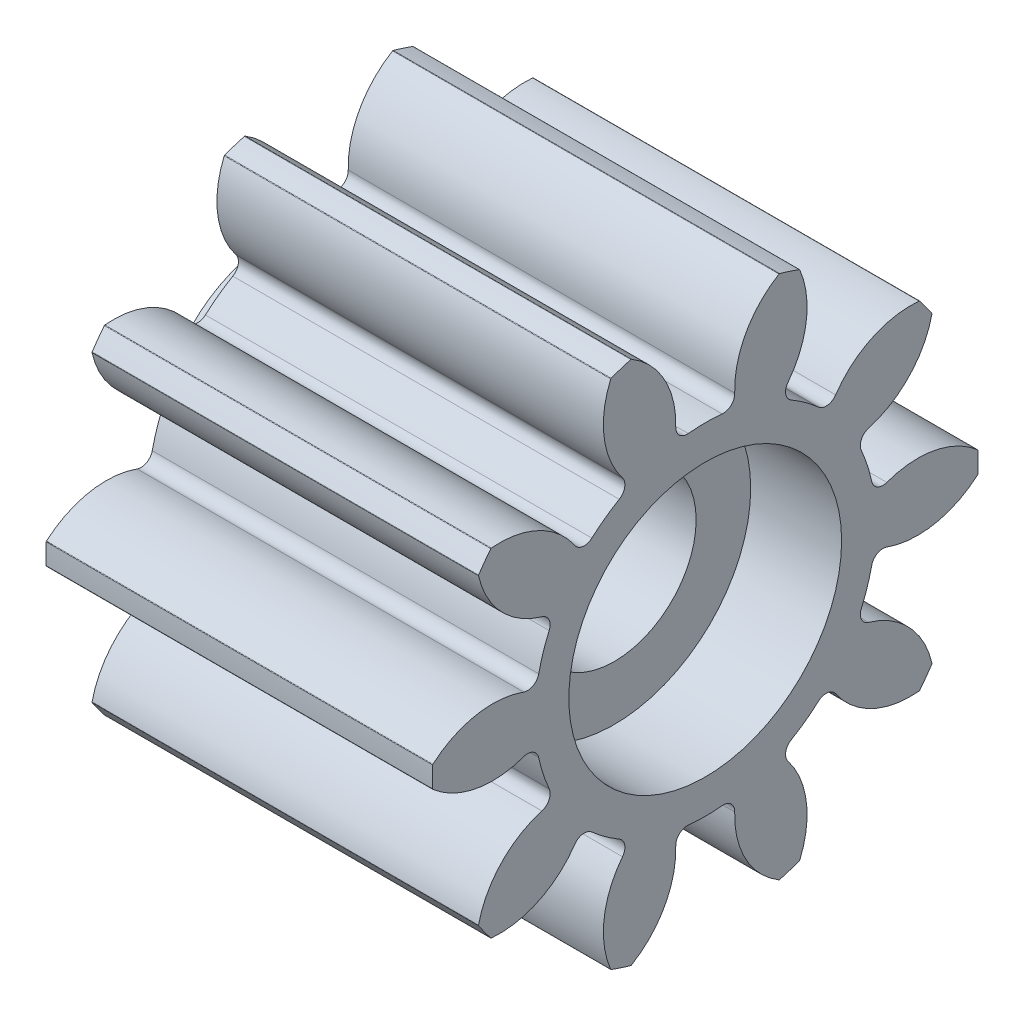
from build123d import *
from build123d.topology import SkipClean

# Parameters (mm, degrees)
BASPROSKE_W                = 8.5
BASPROSKE_H                = 6
TOOTHCUT_DEPTH             = 13.010412149
BREAKS_R                   = 0.02
ROOTFILLETS_R              = 0.251
TEETHCUTS_COUNT            = 10
TEETHCUTS_ANGLE            = 324
BREAKS_OF_TEETHCUTS_R      = 0.02
ROOTFILLETS_OF_TEETHCUTS_R = 0.251
BORSKE_R                   = 1.8
BORE_DEPTH                 = 50.0000508
SKETCH3_R                  = 2.5
SKETCH3_R_2                = 1.8
BOSS_EXTRUDE1_DEPTH        = 1
SKETCH4_R                  = 3
CUT_EXTRUDE2_DEPTH         = 2


with BuildPart() as part:
    # BasProSke → Base-Revolve (revolve)
    with BuildSketch(Plane(origin=(0, 0, 0), x_dir=(1, 0, 0), z_dir=(0, 1, 0))):
        with Locations((4.25, 3)):
            Rectangle(BASPROSKE_W, BASPROSKE_H)
    revolve(axis=Axis((-10, 0, 0), (1, 0, 0)))

    # TooCutSke → ToothCut (cut, through all)
    with BuildSketch(Plane(origin=(0, 0, 0), x_dir=(0, 0, -1), z_dir=(1, 0, 0))):
        with BuildLine():
            ThreePointArc((0.680948119, 3.686639481), (0, 3.749), (-0.680948119, 3.686639481))
            ThreePointArc((-0.680948119, 3.686639481), (-0.833594699, 4.896067871), (-1.659981216, 5.7922282))
            ThreePointArc((-1.659981216, 5.7922282), (0, 6.0254), (1.659981216, 5.7922282))
            ThreePointArc((1.659981216, 5.7922282), (0.833594699, 4.896067871), (0.680948119, 3.686639481))
        make_face()
    toothcut = extrude(amount=TOOTHCUT_DEPTH, mode=Mode.SUBTRACT)

    # Breaks
    breaks_edges = [part.edges().sort_by_distance(p)[0] for p in [
        (4.25, 5.774516397, -1.629404918),
        (4.25, 5.774516397, 1.629404918),
    ]]
    fillet(breaks_edges, radius=BREAKS_R)

    # RootFillets
    rootfillets_edges = [part.edges().sort_by_distance(p)[0] for p in [
        (4.25, 3.686639481, -0.680948119),
        (4.25, 3.686639481, 0.680948119),
    ]]
    fillet(rootfillets_edges, radius=ROOTFILLETS_R)

    # TeethCuts: ToothCut ×10 about axis
    teethcuts_axis = Axis((-10, 0, 0), (1, 0, 0))
    for i in range(1, TEETHCUTS_COUNT):
        add(toothcut.rotate(teethcuts_axis, i * TEETHCUTS_ANGLE / (TEETHCUTS_COUNT - 1)), mode=Mode.SUBTRACT)

    # Breaks of TeethCuts
    breaks_of_teethcuts_edges = [part.edges().sort_by_distance(p)[0] for p in [
        (4.25, 5.62942208, 2.075959308),
        (4.25, 3.713941719, 4.712391846),
        (4.25, 3.334079865, 4.988377637),
        (4.25, 0.234767536, 5.995405258),
        (4.25, -0.234767536, 5.995405258),
        (4.25, -3.334079865, 4.988377637),
        (4.25, -3.713941719, 4.712391846),
        (4.25, -5.62942208, 2.075959308),
        (4.25, -5.774516397, 1.629404918),
        (4.25, -5.774516397, -1.629404918),
        (4.25, -5.62942208, -2.075959308),
        (4.25, -3.713941719, -4.712391846),
        (4.25, -3.334079865, -4.988377637),
        (4.25, -0.234767536, -5.995405258),
        (4.25, 0.234767536, -5.995405258),
        (4.25, 3.334079865, -4.988377637),
        (4.25, 3.713941719, -4.712391846),
        (4.25, 5.62942208, -2.075959308),
    ]]
    fillet(breaks_of_teethcuts_edges, radius=BREAKS_OF_TEETHCUTS_R)

    # RootFillets of TeethCuts
    rootfillets_of_teethcuts_edges = [part.edges().sort_by_distance(p)[0] for p in [
        (4.25, 3.382805254, 1.616053717),
        (4.25, 2.58230273, 2.717850918),
        (4.25, 1.786854397, 3.29577796),
        (4.25, 0.491614106, 3.716627042),
        (4.25, -0.491614106, 3.716627042),
        (4.25, -1.786854397, 3.29577796),
        (4.25, -2.58230273, 2.717850918),
        (4.25, -3.382805254, 1.616053717),
        (4.25, -3.686639481, 0.680948119),
        (4.25, -3.686639481, -0.680948119),
        (4.25, -3.382805254, -1.616053717),
        (4.25, -2.58230273, -2.717850918),
        (4.25, -1.786854397, -3.29577796),
        (4.25, -0.491614106, -3.716627042),
        (4.25, 0.491614106, -3.716627042),
        (4.25, 1.786854397, -3.29577796),
        (4.25, 2.58230273, -2.717850918),
        (4.25, 3.382805254, -1.616053717),
    ]]
    fillet(rootfillets_of_teethcuts_edges, radius=ROOTFILLETS_OF_TEETHCUTS_R)

    # BorSke → Bore (cut, symmetric)
    with BuildSketch(Plane(origin=(0, 0, 0), x_dir=(0, 0, -1), z_dir=(1, 0, 0))):
        Circle(BORSKE_R)
    extrude(amount=BORE_DEPTH, both=True, mode=Mode.SUBTRACT)

    # Sketch3 → Boss-Extrude1 (add)
    with SkipClean():  # the faces are left unmerged after this step: merging them gives an invalid solid
        with BuildSketch(Plane.ZY):
            Circle(SKETCH3_R)
            Circle(SKETCH3_R_2, mode=Mode.SUBTRACT)
        extrude(amount=BOSS_EXTRUDE1_DEPTH)

    # Sketch4 → Cut-Extrude2 (cut)
    with SkipClean():  # the faces are left unmerged after this step: merging them gives an invalid solid
        with BuildSketch(Plane(origin=(8.5, 0, 0), x_dir=(0, 0, -1), z_dir=(1, 0, 0))):
            Circle(SKETCH4_R)
        extrude(amount=-CUT_EXTRUDE2_DEPTH, mode=Mode.SUBTRACT)


solid = part.part
